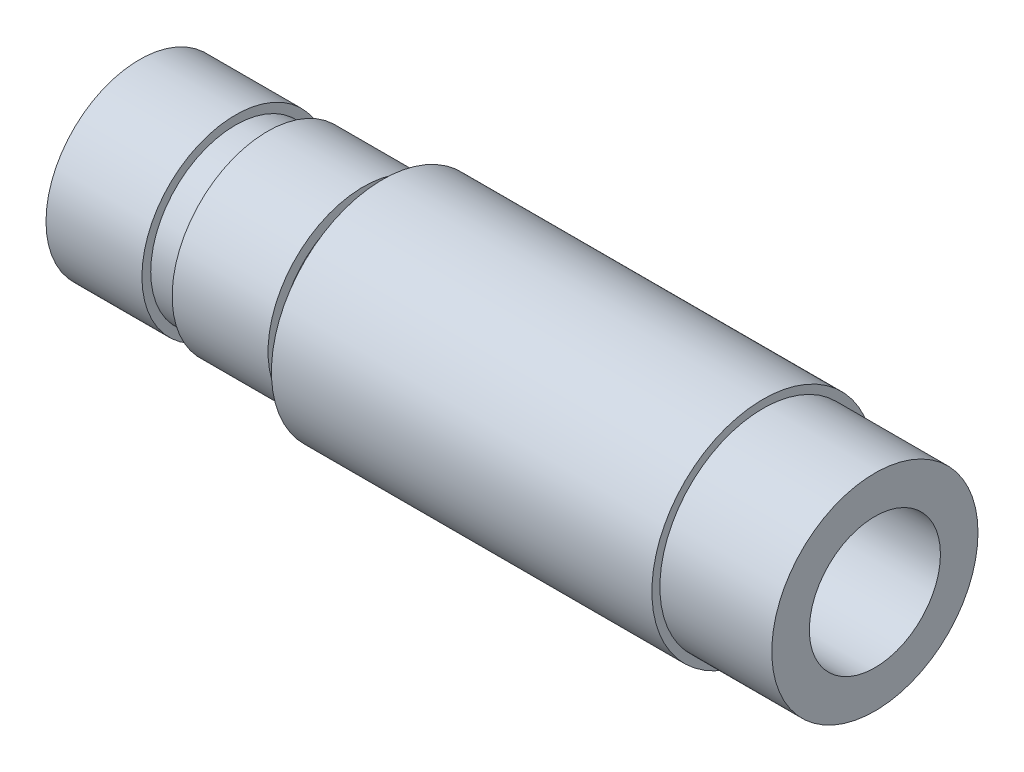
from build123d import *

# Parameters (mm, degrees)
TAP_DRILL_FOR_M5_TAP1_D     = 4.1
TAP_DRILL_FOR_M5_TAP1_DEPTH = 5.5
TAP_DRILL_FOR_M5_TAP1_TIP   = 1.231764269
SKETCH5_R                   = 1.75
CUT_EXTRUDE1_DEPTH          = 29.8


with BuildPart() as part:
    # Sketch2 → Revolve4 (revolve)
    with BuildSketch(Plane.XY):
        Polygon((284.762244726, 76.84385353), (307.762244726, 76.84385353), (307.762244726, 80.06885353), (304.262244726, 80.06885353), (304.262244726, 80.31885353), (292.362244726, 80.31885353), (292.362244726, 79.49385353), (291.762244726, 79.49385353), (291.762244726, 79.82385353), (288.762244726, 79.82385353), (288.762244726, 79.49385353), (287.762244726, 79.49385353), (287.762244726, 79.76885353), (284.762244726, 79.76885353), align=None)
    revolve(axis=Axis((307.762244726, 76.84385353, 0), (-1, 0, 0)))

    # Tap Drill for M5 Tap1
    with Locations(Plane(origin=(307.762244726, 0, 0), x_dir=(0, 0, -1), z_dir=(1, 0, 0))):
        with Locations((0, 76.84385353)):
            Hole(TAP_DRILL_FOR_M5_TAP1_D / 2, depth=TAP_DRILL_FOR_M5_TAP1_DEPTH)
            with Locations((0, 0, -(TAP_DRILL_FOR_M5_TAP1_DEPTH + TAP_DRILL_FOR_M5_TAP1_TIP / 2))):  # 118° drill point
                Cone(0, TAP_DRILL_FOR_M5_TAP1_D / 2, TAP_DRILL_FOR_M5_TAP1_TIP, mode=Mode.SUBTRACT)

    # Sketch5 → Cut-Extrude1 (cut)
    with BuildSketch(Plane.ZY.offset(-284.762244726)):
        with Locations((0, 76.84385353)):
            Circle(SKETCH5_R)
    extrude(amount=-CUT_EXTRUDE1_DEPTH, mode=Mode.SUBTRACT)


solid = part.part
